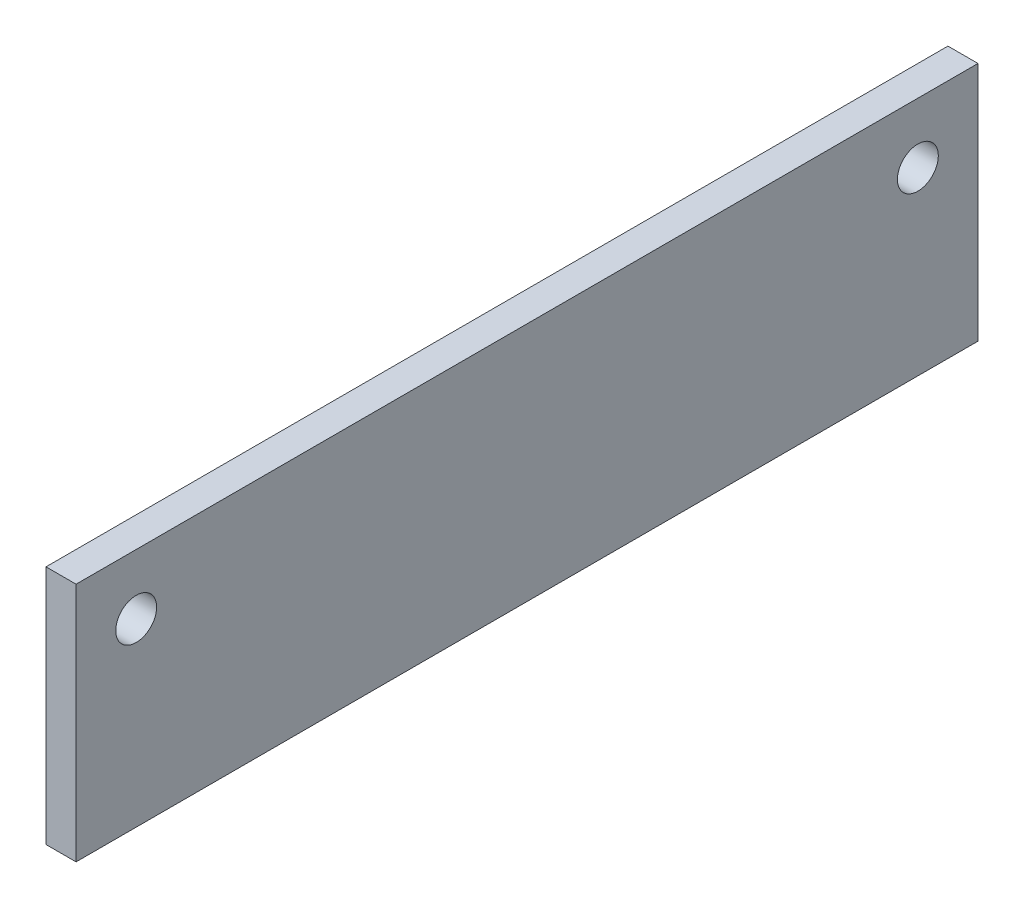
from build123d import *

# Parameters (mm, degrees)
SKETCH1_W           = 75
SKETCH1_H           = 20
SKETCH1_R           = 1.7
BOSS_EXTRUDE1_DEPTH = 2.5


with BuildPart() as part:
    # Sketch1 → Boss-Extrude1 (new body)
    with BuildSketch(Plane(origin=(0, 0, 0), x_dir=(0, 0, -1), z_dir=(1, 0, 0))):
        Rectangle(SKETCH1_W, SKETCH1_H)
        with Locations((-32.5, 5)):
            Circle(SKETCH1_R, mode=Mode.SUBTRACT)
        with Locations((32.5, 5)):
            Circle(SKETCH1_R, mode=Mode.SUBTRACT)
    extrude(amount=BOSS_EXTRUDE1_DEPTH)


solid = part.part
